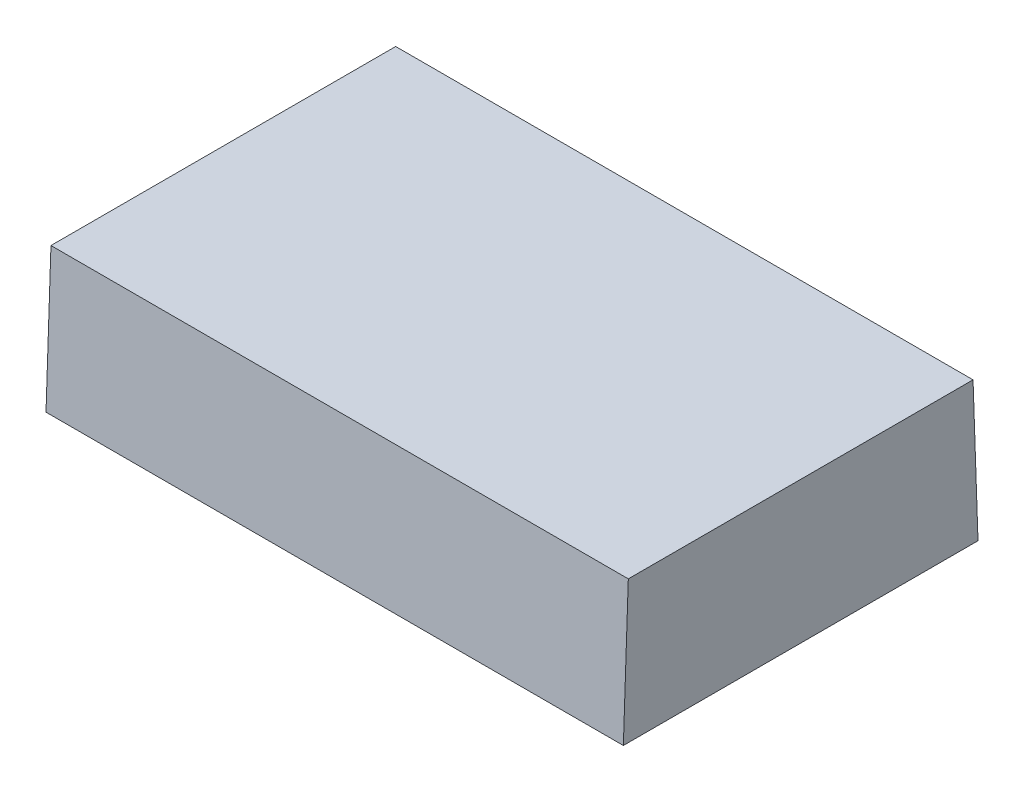
from build123d import *

# Parameters (mm, degrees)
BOSS_EXTRUDE5_DEPTH = 206.756
SHELL2_T            = 6.35


with BuildPart() as part:
    # Sketch6 → Boss-Extrude5 (new body)
    with BuildSketch(Plane(origin=(0, 0, 0), x_dir=(0, 0, -1), z_dir=(1, 0, 0))):
        Polygon((-63.5, -25.4), (63.5, -25.4), (61.72602491, 25.4), (-61.72602491, 25.4), align=None)
    extrude(amount=BOSS_EXTRUDE5_DEPTH)

    # Shell2 (no face opened: a closed hollow body)
    add(offset(amount=-SHELL2_T, mode=Mode.PRIVATE), mode=Mode.SUBTRACT)


solid = part.part
